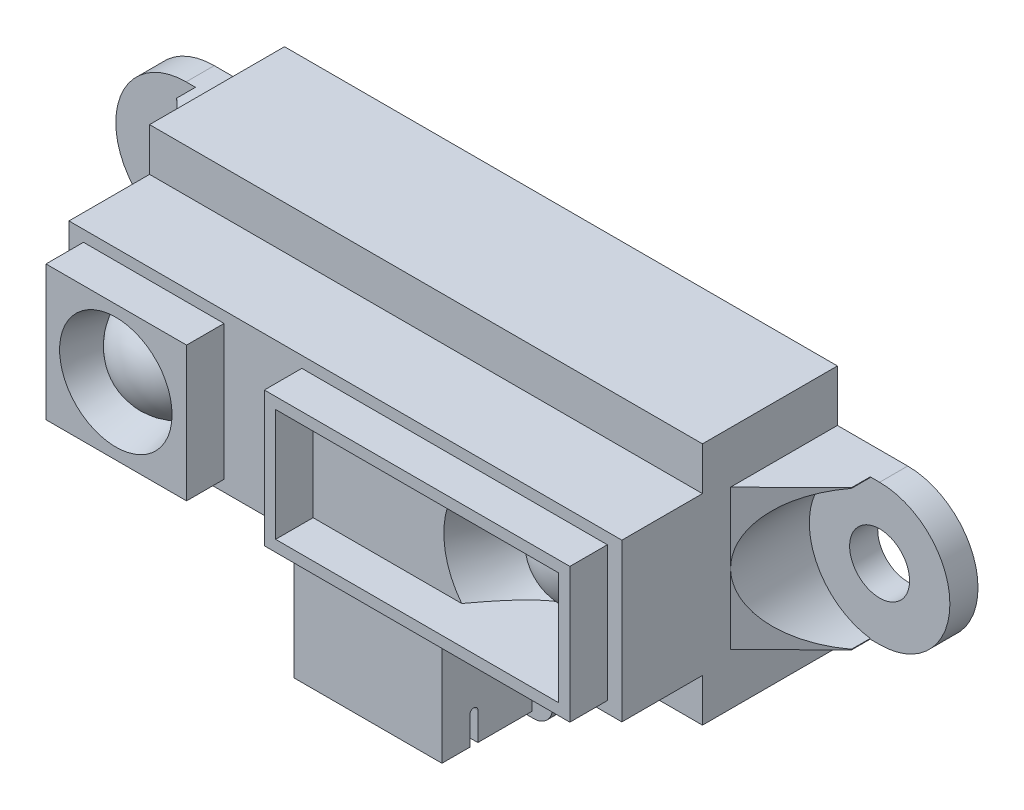
from build123d import *

# Parameters (mm, degrees)
SKETCH2_R                = 1.6
BOSS_EXTRUDE1_DEPTH      = 7.2
CUT_EXTRUDE1_DEPTH       = 84.563926387
SKETCH5_R                = 3.75
CUT_EXTRUDE2_DEPTH       = 87.349960246
SKETCH6_W                = 29.5
SKETCH6_H                = 8.4
BOSS_EXTRUDE2_DEPTH      = 4.3
SKETCH7_W                = 7.5
SKETCH7_H                = 7.2
SKETCH7_R                = 2.5
SKETCH7_W_2              = 16.3
SKETCH7_W_3              = 15.1
SKETCH7_H_2              = 6
BOSS_EXTRUDE3_DEPTH      = 2
CHAMFER1_SIZE2           = 2
CHAMFER1_SIZE            = 0.5
SKETCH8_R                = 2.5
CUT_EXTRUDE3_DEPTH       = 3
CHAMFER2_SIZE            = 2
CHAMFER2_SIZE_2          = 3.464101615
SKETCH9_W                = 28.3
SKETCH9_H                = 11.8
CUT_EXTRUDE4_DEPTH       = 5.5
BOSS_EXTRUDE4_DEPTH      = 1.2
FILLET1_R                = 1
BOSS_EXTRUDE5_DEPTH      = 3.95
BOSS_EXTRUDE5_DEPTH_BACK = 3.95
SKETCH17_W               = 6.9
SKETCH17_H               = 3.8
CUT_EXTRUDE5_DEPTH       = 5.8
SKETCH18_R               = 0.5
BOSS_EXTRUDE6_DEPTH      = 5.5
FILLET2_R                = 0.5


# Some blends are built 0.0001 mm under size
with BuildPart() as part:
    # Sketch2 → Boss-Extrude1 (new body)
    with BuildSketch(Plane.XY):
        with BuildLine():
            Line((-74.731926848, 25.724226739), (-45.231926848, 25.724226739))
            Line((-45.231926848, 25.724226739), (-45.231926848, 22.974226739))
            Line((-45.231926848, 22.974226739), (-41.481926848, 22.974226739))
            ThreePointArc((-41.481926848, 22.974226739), (-37.731926848, 19.224226739), (-41.481926848, 15.474226739))
            Line((-41.481926848, 15.474226739), (-45.231926848, 15.474226739))
            Line((-45.231926848, 15.474226739), (-45.231926848, 12.724226739))
            Line((-45.231926848, 12.724226739), (-54.931926848, 12.724226739))
            Line((-54.931926848, 12.724226739), (-54.931926848, 15.024226739))
            Line((-54.931926848, 15.024226739), (-65.031926848, 15.024226739))
            Line((-65.031926848, 15.024226739), (-65.031926848, 12.724226739))
            Line((-65.031926848, 12.724226739), (-74.731926848, 12.724226739))
            Line((-74.731926848, 12.724226739), (-74.731926848, 15.474226739))
            Line((-74.731926848, 15.474226739), (-78.481926848, 15.474226739))
            ThreePointArc((-78.481926848, 15.474226739), (-82.231926848, 19.224226739), (-78.481926848, 22.974226739))
            Line((-78.481926848, 22.974226739), (-74.731926848, 22.974226739))
            Line((-74.731926848, 22.974226739), (-74.731926848, 25.724226739))
        make_face()
        with Locations((-78.481926848, 19.224226739)):
            Circle(SKETCH2_R, mode=Mode.SUBTRACT)
        with Locations((-41.481926848, 19.224226739)):
            Circle(SKETCH2_R, mode=Mode.SUBTRACT)
    extrude(amount=BOSS_EXTRUDE1_DEPTH)

    # Sketch4 → Cut-Extrude1 (cut, through all)
    with BuildSketch(Plane.XZ.offset(-12.724226739)):
        Polygon((-74.731926848, 5.7), (-77.981926848, 2.5), (-77.981926848, 1.5), (-84.83036896, 1.5), (-84.83036896, 9.527639916), (-74.731926848, 9.527639916), align=None)
        Polygon((-45.231926848, 9.527639916), (-45.231926848, 5.7), (-41.981926848, 2.5), (-41.981926848, 1.5), (-35.133484736, 1.5), (-35.133484736, 9.527639916), align=None)
    extrude(amount=-CUT_EXTRUDE1_DEPTH, mode=Mode.SUBTRACT)

    # Sketch5 → Cut-Extrude2 (cut, through all)
    with BuildSketch(Plane.XY.offset(1.5)):
        with Locations((-78.481926848, 19.224226739)):
            Circle(SKETCH5_R)
        with Locations((-41.481926848, 19.224226739)):
            Circle(SKETCH5_R)
    extrude(amount=CUT_EXTRUDE2_DEPTH, mode=Mode.SUBTRACT)

    # Sketch6 → Boss-Extrude2 (add)
    with BuildSketch(Plane.XY.offset(7.2)):
        with Locations((-59.981926848, 19.224226739)):
            Rectangle(SKETCH6_W, SKETCH6_H)
    extrude(amount=BOSS_EXTRUDE2_DEPTH)

    # Sketch7 → Boss-Extrude3 (add)
    # profile 1 of 2: a face of its own
    with BuildSketch(Plane.XY.offset(11.5)):
        with Locations((-70.206926848, 19.224226739)):
            Rectangle(SKETCH7_W, SKETCH7_H)
        with Locations((-70.231926848, 19.224226739)):
            Circle(SKETCH7_R, mode=Mode.SUBTRACT)
    # profile 2 of 2: a face of its own
    with BuildSketch(Plane.XY.offset(11.5)):
        with Locations((-54.156926848, 19.224226739)):
            Rectangle(SKETCH7_W_2, SKETCH7_H)
        with Locations((-54.156926848, 19.224226739)):
            Rectangle(SKETCH7_W_3, SKETCH7_H_2, mode=Mode.SUBTRACT)
    extrude(amount=BOSS_EXTRUDE3_DEPTH)

    # Chamfer1
    chamfer1_edges = [part.edges().sort_by_distance(p)[0] for p in [
        (-72.731926848, 19.224226739, 13.5),
    ]]
    chamfer1_side = [part.faces().sort_by_distance(p)[0] for p in [
        (-72.741926848, 19.224226739, 13.5),
    ]]
    chamfer(chamfer1_edges, length=CHAMFER1_SIZE - 0.0001, length2=CHAMFER1_SIZE2 - 0.0001, reference=chamfer1_side[0])  # a hair under: the kernel refuses the full size

    # Sketch8 → Cut-Extrude3 (cut)
    with BuildSketch(Plane.XY.offset(11.5)):
        with Locations((-50.231926848, 18.99663901)):
            Circle(SKETCH8_R)
    extrude(amount=-CUT_EXTRUDE3_DEPTH, mode=Mode.SUBTRACT)

    # Chamfer2
    # the kernel refuses this chamfer: 3.464101615, 2 mm, written as the material it takes off along each edge
    with BuildSketch(Plane(origin=(-50.231926848, 18.99663901, 11.5), x_dir=(1, 0, 0), z_dir=(0, -1, 0))) as chamfer2_piece_1_section:
        Polygon((2.5 + CHAMFER2_SIZE, 0), (2.5, -CHAMFER2_SIZE_2), (2.5, 0), align=None)
    chamfer2_piece_1 = revolve(axis=Axis((-50.231926848, 18.99663901, 11.5), (0, 0, 1)), mode=Mode.PRIVATE)
    chamfer2_piece_1 = split(chamfer2_piece_1, bisect_by=Plane(origin=(-53.833665029, 16.224226739, 10.018611703), z_dir=(0, 1, 0)), keep=Keep.TOP, mode=Mode.PRIVATE)
    chamfer2_piece_1 = split(chamfer2_piece_1, bisect_by=Plane(origin=(-46.606926848, 18.99663901, 10.018611703), z_dir=(-1, 0, 0)), keep=Keep.TOP, mode=Mode.PRIVATE)
    chamfer2_piece_1 = split(chamfer2_piece_1, bisect_by=Plane(origin=(-53.833665029, 22.224226739, 10.018611703), z_dir=(0, -1, 0)), keep=Keep.TOP, mode=Mode.PRIVATE)
    chamfer2_piece_1 = split(chamfer2_piece_1, bisect_by=Plane(origin=(-53.833665029, 18.99663901, 8.5), z_dir=(0, 0, 1)), keep=Keep.TOP, mode=Mode.PRIVATE)
    add(chamfer2_piece_1, mode=Mode.SUBTRACT)

    # Sketch9 → Cut-Extrude4 (cut)
    with BuildSketch(Plane(origin=(0, 0, 0), x_dir=(-1, 0, 0), z_dir=(0, 0, -1))):
        with Locations((59.981926848, 19.224226739)):
            Rectangle(SKETCH9_W, SKETCH9_H)
    extrude(amount=-CUT_EXTRUDE4_DEPTH, mode=Mode.SUBTRACT)

    # Sketch10 → Boss-Extrude4 (add)
    with BuildSketch(Plane(origin=(0, 0, 5.5), x_dir=(-1, 0, 0), z_dir=(0, 0, -1))):
        Polygon((54.931926848, 13.324226739), (54.931926848, 6.824226739), (65.031926848, 6.824226739), (65.031926848, 13.324226739), (74.131926848, 13.324226739), (74.131926848, 25.124226739), (45.831926848, 25.124226739), (45.831926848, 13.324226739), align=None)
    extrude(amount=BOSS_EXTRUDE4_DEPTH)

    # Sketch11 → Revolve1 (revolve)
    with BuildSketch(Plane(origin=(0, 18.99663901, 0), x_dir=(1, 0, 0), z_dir=(0, 1, 0))):
        with BuildLine():
            Line((-50.231926848, -8.5), (-47.463977656, -8.5))
            ThreePointArc((-47.463977656, -8.5), (-48.524476795, -9.947681814), (-50.231926848, -10.5))
            Line((-50.231926848, -10.5), (-50.231926848, -8.5))
        make_face()
    revolve(axis=Axis((-50.231926848, 18.99663901, 8.5), (0, 0, 1)))

    # Sketch14 → Revolve2 (revolve)
    with BuildSketch(Plane(origin=(0, 19.224226739, 0), x_dir=(-1, 0, 0), z_dir=(0, -1, 0)), mode=Mode.PRIVATE) as revolve2_sk:
        with BuildLine():
            Line((70.231926848, -11.5), (72.731926848, -11.5))
            ThreePointArc((72.731926848, -11.5), (71.689664822, -12.596229956), (70.231926848, -13))
            Line((70.231926848, -13), (70.231926848, -11.5))
        make_face()
    revolve(revolve2_sk.sketch.rotate(Axis((-70.231926848, 19.224226739, 11.5), (0, 0, 1)), 180), axis=Axis((-70.231926848, 19.224226739, 11.5), (0, 0, 1)))

    # Fillet1
    fillet1_edges = [part.edges().sort_by_distance(p)[0] for p in [
        (-65.031926848, 6.824226739, 4.9),
        (-54.931926848, 6.824226739, 4.9),
    ]]
    fillet(fillet1_edges, radius=FILLET1_R)

    # Sketch16 → Boss-Extrude5 (add, two sides: drawn at the far end of the back side and taken through both)
    with BuildSketch(Plane(origin=(-59.981926848, 0, 0), x_dir=(0, 0, -1), z_dir=(1, 0, 0)).offset(-BOSS_EXTRUDE5_DEPTH_BACK)):
        with BuildLine():
            Line((-8.384982209, 8.613050121), (-8.384982209, 7.113050121))
            Line((-8.384982209, 7.113050121), (-5.5, 7.113050121))
            Line((-5.5, 7.113050121), (-5.5, 14.713050121))
            Line((-5.5, 14.713050121), (-7.5, 14.713050121))
            Line((-7.5, 14.713050121), (-9.1, 13.113050121))
            Line((-9.1, 13.113050121), (-10.3, 13.113050121))
            Line((-10.3, 13.113050121), (-10.3, 7.113050121))
            Line((-10.3, 7.113050121), (-8.815017791, 7.113050121))
            Line((-8.815017791, 7.113050121), (-8.815017791, 8.613050121))
            ThreePointArc((-8.815017791, 8.613050121), (-8.6, 8.828067912), (-8.384982209, 8.613050121))
        make_face()
    extrude(amount=BOSS_EXTRUDE5_DEPTH + BOSS_EXTRUDE5_DEPTH_BACK)

    # Sketch17 → Cut-Extrude5 (cut)
    with BuildSketch(Plane.XZ.offset(-7.113050121)):
        with Locations((-59.981926848, 7.9)):
            Rectangle(SKETCH17_W, SKETCH17_H)
    extrude(amount=-CUT_EXTRUDE5_DEPTH, mode=Mode.SUBTRACT)

    # Sketch18 → Boss-Extrude6 (add)
    with BuildSketch(Plane.XZ.offset(-12.913050121)):
        with Locations(Location((-59.981926848, 7.9, 0), (0, 0, 270))):
            Circle(SKETCH18_R)
        with Locations(Location((-57.981926848, 7.9, 0), (0, 0, 270))):
            Circle(SKETCH18_R)
        with Locations(Location((-61.981926848, 7.9, 0), (0, 0, 270))):
            Circle(SKETCH18_R)
    extrude(amount=BOSS_EXTRUDE6_DEPTH)

    # Fillet2
    fillet2_edges = [part.edges().sort_by_distance(p)[0] for p in [
        (-59.981926848, 7.413050121, 8.4),
        (-57.981926848, 7.413050121, 8.4),
        (-61.981926848, 7.413050121, 8.4),
    ]]
    fillet(fillet2_edges, radius=FILLET2_R)


solid = part.part
